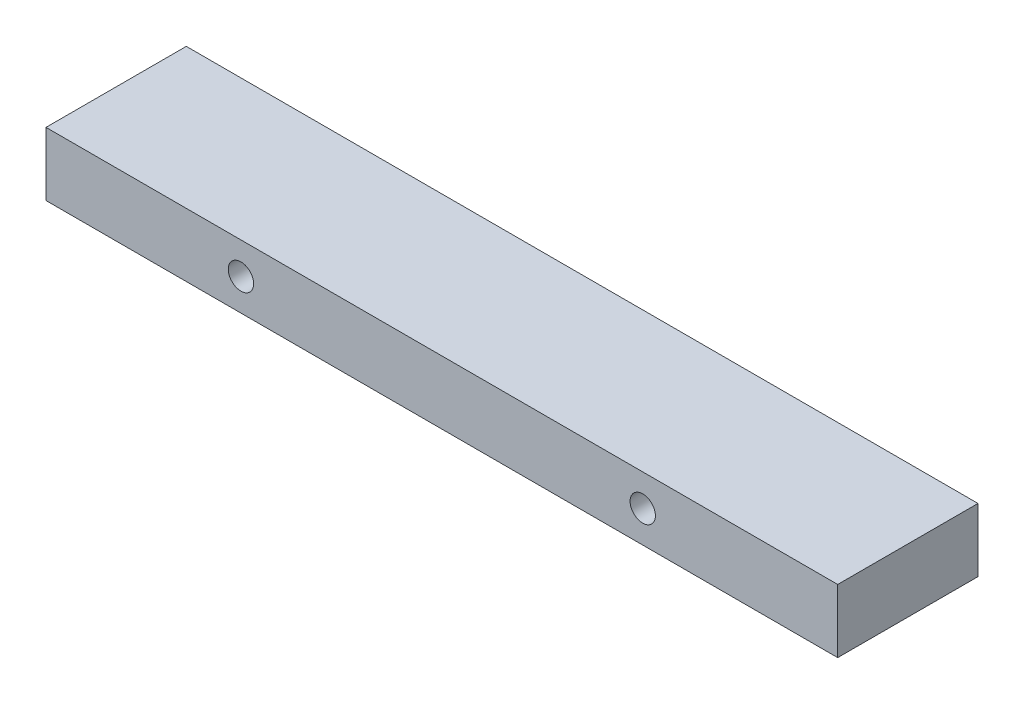
from build123d import *

# Parameters (mm, degrees)
SKETCH_1_W                 = 49.95
SKETCH_1_H                 = 4
FRONT_PLATE_DEPTH          = 8.851909566
SKETCH_2_R                 = 0.8
FRAME_2XD1P6_THROUGH_DEPTH = 51.615894766


with BuildPart() as part:
    # 草图1 → Front_Plate (new body)
    with BuildSketch(Plane.XY):
        with Locations((24.675, -2.3)):
            Rectangle(SKETCH_1_W, SKETCH_1_H)
    extrude(amount=FRONT_PLATE_DEPTH)


with BuildPart() as part_1:
    # Stock_Z_Position: moved
    add(part.part.moved(Location((0, 0, 2.248090434))))

    # 草图2 → Frame_2xD1p6_Through (cut, through all)
    with BuildSketch(Plane.XY.offset(11.1)):
        with Locations((12, -2.3)):
            Circle(SKETCH_2_R)
        with Locations((37.35, -2.3)):
            Circle(SKETCH_2_R)
    extrude(amount=-FRAME_2XD1P6_THROUGH_DEPTH, mode=Mode.SUBTRACT)


solid = part_1.part
